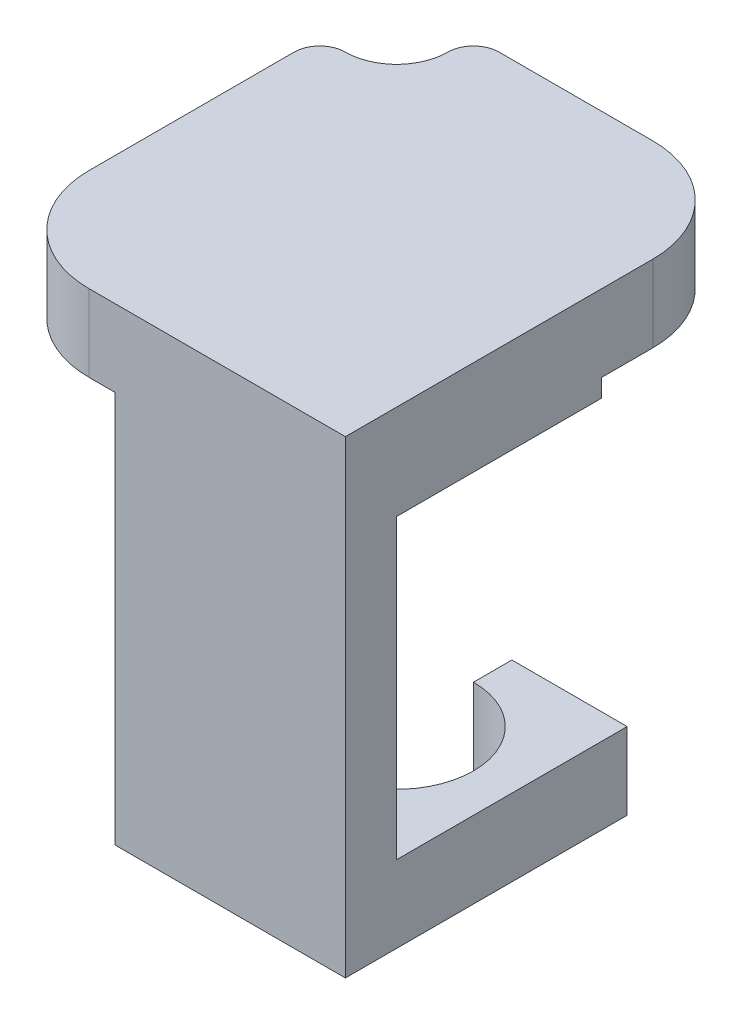
from build123d import *

# Parameters (mm, degrees)
ESQUISSE1_W             = 9
ESQUISSE1_H             = 9
BOSS_EXTRU_1_DEPTH      = 3
ENL_V_MAT_EXTRU_1_DEPTH = 20.782165931
ESQUISSE3_W             = 9
ESQUISSE3_H             = 18.3
BOSS_EXTRU_3_DEPTH      = 2
ESQUISSE4_W             = 9
ESQUISSE4_H             = 3.7
BOSS_EXTRU_4_DEPTH      = 8
BOSS_EXTRU_6_DEPTH      = 3
BOSS_EXTRU_8_DEPTH      = 1
CONG_2_R                = 4
CONG_3_R                = 2
ESQUISSE7_R             = 1.329968568
ENL_V_MAT_EXTRU_2_DEPTH = 1
CONG_4_R                = 1


with BuildPart() as part:
    # Esquisse1 → Boss.-Extru.1 (new body)
    with BuildSketch(Plane(origin=(0, 0, 0), x_dir=(1, 0, 0), z_dir=(0, 1, 0))):
        with Locations((-8.852843945, 9.784104714)):
            Rectangle(ESQUISSE1_W, ESQUISSE1_H)
    extrude(amount=-BOSS_EXTRU_1_DEPTH)

    # Esquisse2 → Enlèv. mat.-Extru.1 (cut, through all)
    with BuildSketch(Plane.XZ.offset(3)):
        with BuildLine():
            Line((-8.852843945, -12.784104714), (-8.852843945, -14.284104714))
            Line((-8.852843945, -14.284104714), (-13.352843945, -14.284104714))
            Line((-13.352843945, -14.284104714), (-13.352843945, -9.784104714))
            Line((-13.352843945, -9.784104714), (-11.852843945, -9.784104714))
            ThreePointArc((-11.852843945, -9.784104714), (-6.731523602, -7.66278437), (-8.852843945, -12.784104714))
        make_face()
    extrude(amount=-ENL_V_MAT_EXTRU_1_DEPTH, mode=Mode.SUBTRACT)

    # Esquisse3 → Boss.-Extru.3 (add)
    with BuildSketch(Plane.XY.offset(-5.284104714)):
        with Locations((-8.852843945, 6.15)):
            Rectangle(ESQUISSE3_W, ESQUISSE3_H)
    extrude(amount=BOSS_EXTRU_3_DEPTH)

    # Esquisse4 → Boss.-Extru.4 (add)
    with BuildSketch(Plane(origin=(0, 0, -5.284104714), x_dir=(-1, 0, 0), z_dir=(0, 0, -1))):
        with Locations((8.852843945, 13.45)):
            Rectangle(ESQUISSE4_W, ESQUISSE4_H)
    extrude(amount=BOSS_EXTRU_4_DEPTH)

    # Esquisse8 → Boss.-Extru.6 (add)
    with BuildSketch(Plane(origin=(0, 15.3, 0), x_dir=(1, 0, 0), z_dir=(0, 1, 0))):
        Polygon((-18.352843945, 3.284104714), (-4.352843945, 3.284104714), (-4.352843945, 19.284104714), (-13.352843945, 19.284104714), (-13.352843945, 14.284104714), (-18.352843945, 14.284104714), align=None)
    extrude(amount=-BOSS_EXTRU_6_DEPTH)

    # Esquisse9 → Boss.-Extru.8 (add)
    with BuildSketch(Plane(origin=(0, 15.3, 0), x_dir=(1, 0, 0), z_dir=(0, 1, 0))):
        Polygon((-18.352843945, 16.284104714), (-18.352843945, 3.284104714), (-4.352843945, 3.284104714), (-4.352843945, 19.284104714), (-15.352843945, 19.284104714), (-15.352843945, 16.284104714), align=None)
    extrude(amount=-BOSS_EXTRU_8_DEPTH)

    # Congé2
    cong_2_edges = [part.edges().sort_by_distance(p)[0] for p in [
        (-18.352843945, 13.8, -3.284104714),
        (-4.352843945, 13.8, -19.284104714),
    ]]
    fillet(cong_2_edges, radius=CONG_2_R)

    # Congé3
    cong_3_edges = [part.edges().sort_by_distance(p)[0] for p in [
        (-15.352843945, 14.8, -16.284104714),
    ]]
    fillet(cong_3_edges, radius=CONG_3_R)

    # Esquisse7 → Enlèv. mat.-Extru.2 (cut)
    with BuildSketch(Plane.XZ.offset(-11.6)):
        with Locations(Location((-8.852843945, -9.784104714, 0), (0, 0, 270))):
            Circle(ESQUISSE7_R)
    extrude(amount=-ENL_V_MAT_EXTRU_2_DEPTH, mode=Mode.SUBTRACT)

    # Congé4
    cong_4_edges = [part.edges().sort_by_distance(p)[0] for p in [
        (-15.352843945, 14.8, -19.284104714),
        (-18.352843945, 14.8, -16.284104714),
    ]]
    fillet(cong_4_edges, radius=CONG_4_R - 0.0001)  # a hair under: the kernel refuses the full size


solid = part.part
